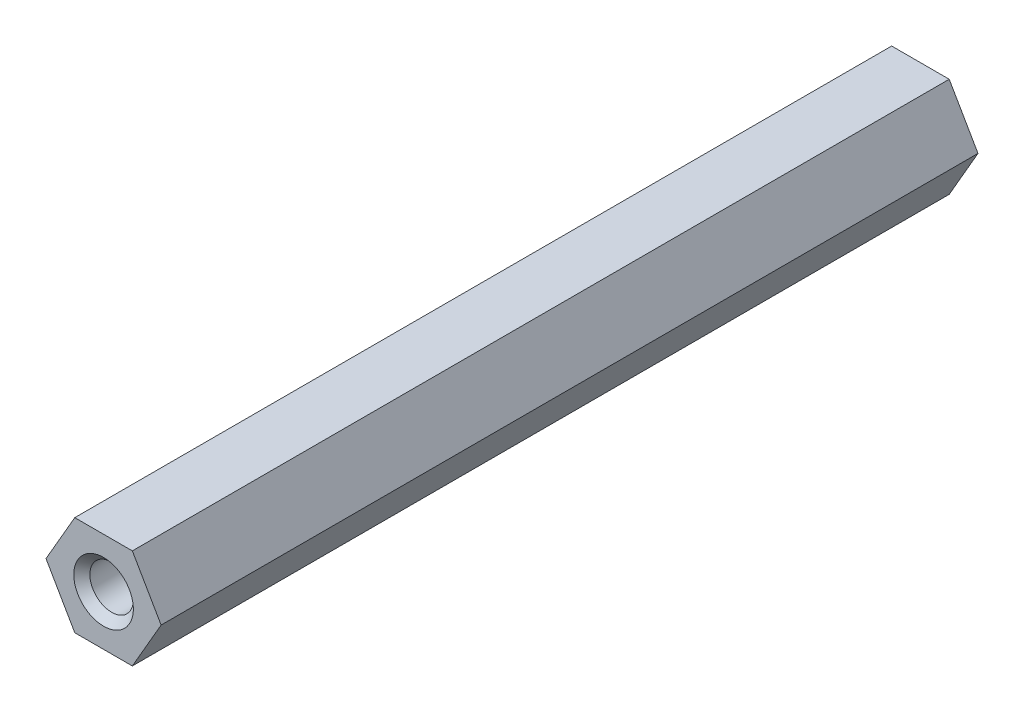
from build123d import *

# Parameters (mm, degrees)
EXTRUDE1_DEPTH        = 50.8
F_6_32_TAPPED_HOLE8_D = 2.7051
CHAMFER1_SIZE         = 0.5
CHAMFER2_SIZE         = 0.5


with BuildPart() as part:
    # Sketch1 → Extrude1 (new body)
    with BuildSketch(Plane.XY):
        Polygon((3.579571669, 0), (1.789785834, 3.1), (-1.789785834, 3.1), (-3.579571669, 0), (-1.789785834, -3.1), (1.789785834, -3.1), align=None)
    extrude(amount=-EXTRUDE1_DEPTH)

    # #6-32 Tapped Hole8 (through all)
    with Locations(Plane(origin=(0.000428254, 0.000741758, 0), x_dir=(1, 0, 0), z_dir=(0, 0, 1))):
        with Locations((0, 0)):
            Hole(F_6_32_TAPPED_HOLE8_D / 2)

    # Chamfer1
    chamfer1_edges = [part.edges().sort_by_distance(p)[0] for p in [
        (1.352978254, 0.000741758, 0),
    ]]
    chamfer(chamfer1_edges, length=CHAMFER1_SIZE)

    # Chamfer2
    chamfer2_edges = [part.edges().sort_by_distance(p)[0] for p in [
        (1.352978254, 0.000741758, -50.8),
    ]]
    chamfer(chamfer2_edges, length=CHAMFER2_SIZE)


solid = part.part
